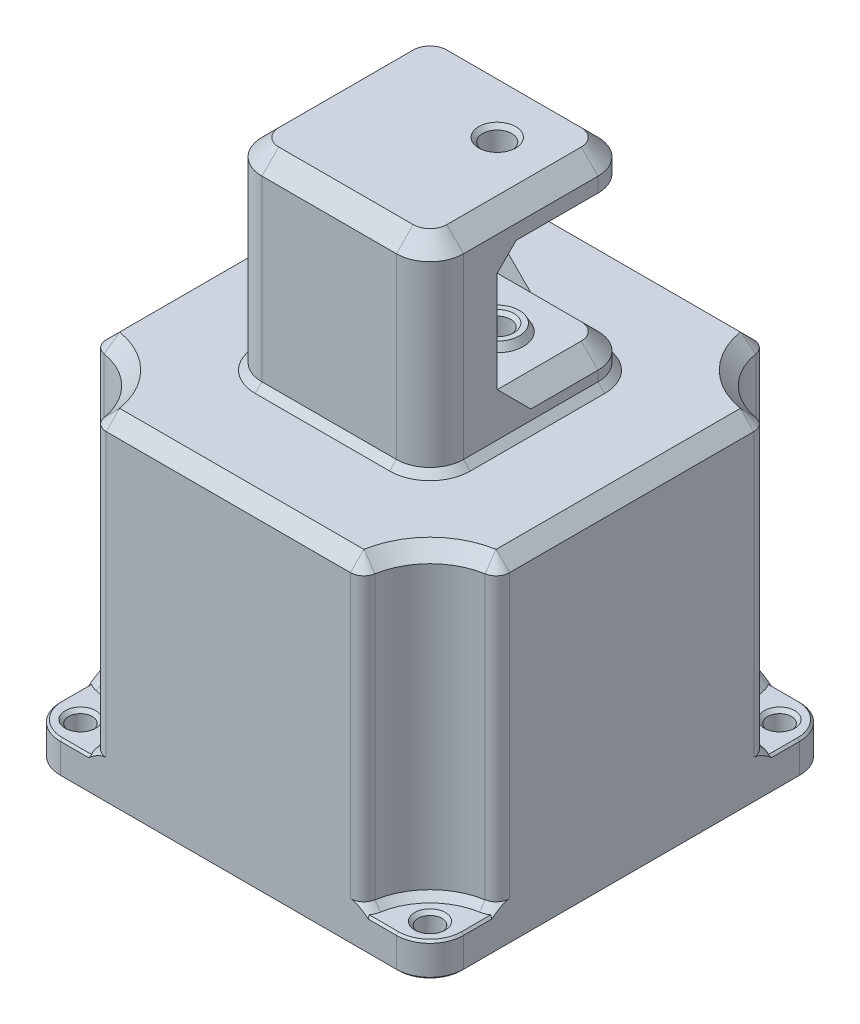
from build123d import *

# Parameters (mm, degrees)
BOSS_EXTRUDE1_DEPTH                  = 6.35
BOSS_EXTRUDE7_DEPTH                  = 63.5
SKETCH2_W                            = 38.1
SKETCH2_H                            = 38.1
BOSS_EXTRUDE2_DEPTH                  = 69.85
BOSS_EXTRUDE3_DEPTH                  = 95.25
BOSS_EXTRUDE4_START                  = 95.25
SKETCH2_5_W                          = 25.4
SKETCH2_5_H                          = 25.4
SKETCH2_5_R                          = 4.175
BOSS_EXTRUDE4_DEPTH                  = 6.35
F_8_0_199_DIAMETER_HOLE1_D           = 5.0546
F_8_0_199_DIAMETER_HOLE1_DEPTH       = 8.89
F_8_0_199_DIAMETER_HOLE1_CSINK_D     = 6.3246
F_8_0_199_DIAMETER_HOLE1_CSINK_ANGLE = 90
F_8_0_199_DIAMETER_HOLE1_TIP         = 1.518555042
F_8_CLEARANCE_HOLE1_AT_2_COUNT       = 2
F_8_CLEARANCE_HOLE1_AT_2_PITCH       = 66.04
F_8_CLEARANCE_HOLE1_AT_3_COUNT       = 2
F_8_CLEARANCE_HOLE1_AT_3_PITCH       = 93.394663659
F_8_CLEARANCE_HOLE1_AT_4_COUNT       = 2
F_8_CLEARANCE_HOLE1_AT_4_PITCH       = 66.04
FILLET2_R                            = 6.35
FILLET4_R                            = 2.54
CHAMFER2_SIZE                        = 3.175
CHAMFER3_SIZE                        = 3.175
CHAMFER5_SIZE                        = 1.27
CHAMFER6_SIZE                        = 2.54
CHAMFER7_SIZE                        = 1.27
CHAMFER4_SIZE                        = 0.396875


# Read off the part's stored shape, not the designer's step: Boss-Extrude5, Boss-Extrude6
# Some blends are built 0.0001 mm under size
with BuildPart() as part:
    # Sketch1 → Boss-Extrude1 (new body)
    with BuildSketch(Plane(origin=(0, 0, 0), x_dir=(1, 0, 0), z_dir=(0, 1, 0))):
        with BuildLine():
            Line((-38.1, -25.4), (-38.1, -38.1))
            Line((-38.1, -38.1), (-25.4, -38.1))
            ThreePointArc((-25.4, -38.1), (-29.119743879, -29.119743879), (-38.1, -25.4))
        make_face()
        with BuildLine():
            ThreePointArc((-38.1, -25.4), (-29.119743879, -29.119743879), (-25.4, -38.1))
            Line((-25.4, -38.1), (25.4, -38.1))
            ThreePointArc((25.4, -38.1), (29.119743879, -29.119743879), (38.1, -25.4))
            Line((38.1, -25.4), (38.1, 25.4))
            ThreePointArc((38.1, 25.4), (29.119743879, 29.119743879), (25.4, 38.1))
            Line((25.4, 38.1), (-25.4, 38.1))
            ThreePointArc((-25.4, 38.1), (-29.119743879, 29.119743879), (-38.1, 25.4))
            Line((-38.1, 25.4), (-38.1, -25.4))
        make_face()
        with BuildLine():
            Line((-38.1, 38.1), (-38.1, 25.4))
            ThreePointArc((-38.1, 25.4), (-29.119743879, 29.119743879), (-25.4, 38.1))
            Line((-25.4, 38.1), (-38.1, 38.1))
        make_face()
        with BuildLine():
            ThreePointArc((25.4, 38.1), (29.119743879, 29.119743879), (38.1, 25.4))
            Line((38.1, 25.4), (38.1, 38.1))
            Line((38.1, 38.1), (25.4, 38.1))
        make_face()
        with BuildLine():
            ThreePointArc((38.1, -25.4), (29.119743879, -29.119743879), (25.4, -38.1))
            Line((25.4, -38.1), (38.1, -38.1))
            Line((38.1, -38.1), (38.1, -25.4))
        make_face()
    extrude(amount=BOSS_EXTRUDE1_DEPTH)

    # Sketch1<3> → Boss-Extrude7 (add)
    with BuildSketch(Plane(origin=(0, 0, 0), x_dir=(1, 0, 0), z_dir=(0, 1, 0))):
        with BuildLine():
            ThreePointArc((-38.1, -25.4), (-29.119743879, -29.119743879), (-25.4, -38.1))
            Line((-25.4, -38.1), (25.4, -38.1))
            ThreePointArc((25.4, -38.1), (29.119743879, -29.119743879), (38.1, -25.4))
            Line((38.1, -25.4), (38.1, 25.4))
            ThreePointArc((38.1, 25.4), (29.119743879, 29.119743879), (25.4, 38.1))
            Line((25.4, 38.1), (-25.4, 38.1))
            ThreePointArc((-25.4, 38.1), (-29.119743879, 29.119743879), (-38.1, 25.4))
            Line((-38.1, 25.4), (-38.1, -25.4))
        make_face()
    extrude(amount=BOSS_EXTRUDE7_DEPTH)

    # Sketch2 → Boss-Extrude2 (add)
    with BuildSketch(Plane(origin=(0, 0, 0), x_dir=(1, 0, 0), z_dir=(0, 1, 0))):
        Rectangle(SKETCH2_W, SKETCH2_H)
    extrude(amount=BOSS_EXTRUDE2_DEPTH)

    # Sketch2<3> → Boss-Extrude3 (add)
    with BuildSketch(Plane(origin=(0, 0, 0), x_dir=(1, 0, 0), z_dir=(0, 1, 0))):
        Polygon((-19.05, 19.05), (-19.05, -19.05), (19.05, -19.05), (19.05, -6.35), (-6.35, -6.35), (-6.35, 19.05), align=None)
    extrude(amount=BOSS_EXTRUDE3_DEPTH)

    # Sketch2<5> → Boss-Extrude4 (add)
    # profile 1 of 3: a face of its own
    with BuildSketch(Plane(origin=(0, 0, 0), x_dir=(1, 0, 0), z_dir=(0, 1, 0)).offset(BOSS_EXTRUDE4_START)):
        Polygon((-19.05, 19.05), (-19.05, -19.05), (19.05, -19.05), (19.05, -6.35), (-6.35, -6.35), (-6.35, 19.05), align=None)
    # profile 2 of 3: a face of its own
    with BuildSketch(Plane(origin=(0, 0, 0), x_dir=(1, 0, 0), z_dir=(0, 1, 0)).offset(BOSS_EXTRUDE4_START)):
        with Locations((6.35, 6.35)):
            Rectangle(SKETCH2_5_W, SKETCH2_5_H)
        with Locations((6.35, 6.35)):
            Circle(SKETCH2_5_R, mode=Mode.SUBTRACT)
    # profile 3 of 3: a face of its own
    with BuildSketch(Plane(origin=(0, 0, 0), x_dir=(1, 0, 0), z_dir=(0, 1, 0)).offset(BOSS_EXTRUDE4_START)):
        with Locations((6.35, 6.35)):
            Circle(SKETCH2_5_R)
    extrude(amount=BOSS_EXTRUDE4_DEPTH)

    # Boss-Extrude5 outline → Boss-Extrude5 (revolve)
    with BuildSketch(Plane(origin=(6.35, 0, -6.35), x_dir=(1, 0, 0), z_dir=(0, 0, 1))):
        Polygon((4.175, 71.2), (0, 71.2), (0, 69.85), (4.954422863, 69.85), align=None)
    revolve(axis=Axis((6.35, 0, -6.35), (0, 1, 0)))

    # Boss-Extrude6 outline → Boss-Extrude6 (revolve)
    with BuildSketch(Plane(origin=(6.35, 0, -6.35), x_dir=(1, 0, 0), z_dir=(0, 0, 1))):
        Polygon((0, 95.25), (0, 93.9), (4.175, 93.9), (4.954422863, 95.25), align=None)
    revolve(axis=Axis((6.35, 0, -6.35), (0, 1, 0)))

    # #8 (0.199) Diameter Hole1
    with Locations(Plane(origin=(0, 71.2, 0), x_dir=(1, 0, 0), z_dir=(0, 1, 0))):
        with Locations((6.35, 6.35)):
            CounterSinkHole(F_8_0_199_DIAMETER_HOLE1_D / 2, F_8_0_199_DIAMETER_HOLE1_CSINK_D / 2, depth=F_8_0_199_DIAMETER_HOLE1_DEPTH, counter_sink_angle=F_8_0_199_DIAMETER_HOLE1_CSINK_ANGLE)
            with Locations((0, 0, -(F_8_0_199_DIAMETER_HOLE1_DEPTH + F_8_0_199_DIAMETER_HOLE1_TIP / 2))):  # 118° drill point
                Cone(0, F_8_0_199_DIAMETER_HOLE1_D / 2, F_8_0_199_DIAMETER_HOLE1_TIP, mode=Mode.SUBTRACT)

    # Sketch8 → M5 Clearance Hole1 (revolve, cut)
    with BuildSketch(Plane(origin=(6.35, 93.9, -6.35), x_dir=(0, 0, -1), z_dir=(1, 0, 0))):
        Polygon((0, 0), (0, 7.7), (3.5, 7.7), (2.75, 6.95), (2.75, 0.75), (3.5, 0), align=None)
    revolve(axis=Axis((6.35, 87.55, -6.35), (0, 1, 0)), mode=Mode.SUBTRACT)

    # Sketch17 → #8 Clearance Hole1 (revolve, cut)
    with BuildSketch(Plane(origin=(-33.02, 6.35, -33.02), x_dir=(0, 0, 1), z_dir=(1, 0, 0))):
        Polygon((0, 0), (0, 6.35), (2.8829, 6.35), (2.2479, 5.715), (2.2479, 0.635), (2.8829, 0), align=None)
    f_8_clearance_hole1 = revolve(axis=Axis((-33.02, 12.7, -33.02), (0, -1, 0)), mode=Mode.SUBTRACT)

    # #8 Clearance Hole1 at 2: #8 Clearance Hole1 ×2
    with Locations(*[(i * F_8_CLEARANCE_HOLE1_AT_2_PITCH, 0, 0) for i in range(1, F_8_CLEARANCE_HOLE1_AT_2_COUNT)]):
        add(f_8_clearance_hole1, mode=Mode.SUBTRACT)

    # #8 Clearance Hole1 at 3: #8 Clearance Hole1 ×2
    with Locations(*[Vector(0.7071067811865476, 0, 0.7071067811865476) * (i * F_8_CLEARANCE_HOLE1_AT_3_PITCH) for i in range(1, F_8_CLEARANCE_HOLE1_AT_3_COUNT)]):
        add(f_8_clearance_hole1, mode=Mode.SUBTRACT)

    # #8 Clearance Hole1 at 4: #8 Clearance Hole1 ×2
    with Locations(*[(0, 0, i * F_8_CLEARANCE_HOLE1_AT_4_PITCH) for i in range(1, F_8_CLEARANCE_HOLE1_AT_4_COUNT)]):
        add(f_8_clearance_hole1, mode=Mode.SUBTRACT)

    # Fillet2
    fillet2_edges = [part.edges().sort_by_distance(p)[0] for p in [
        (-6.35, 82.55, 6.35),
        (-38.1, 3.175, 38.1),
        (-38.1, 3.175, -38.1),
        (38.1, 3.175, -38.1),
        (38.1, 3.175, 38.1),
        (19.05, 98.425, -19.05),
        (19.05, 66.675, -19.05),
        (-19.05, 82.55, -19.05),
        (-19.05, 82.55, 19.05),
        (19.05, 82.55, 19.05),
    ]]
    fillet(fillet2_edges, radius=FILLET2_R)

    # Fillet4
    fillet4_edges = [part.edges().sort_by_distance(p)[0] for p in [
        (-25.4, 34.925, 38.1),
        (25.4, 34.925, 38.1),
        (38.1, 34.925, 25.4),
        (38.1, 34.925, -25.4),
        (25.4, 34.925, -38.1),
        (-25.4, 34.925, -38.1),
        (-38.1, 34.925, -25.4),
        (-38.1, 34.925, 25.4),
    ]]
    fillet(fillet4_edges, radius=FILLET4_R)

    # Chamfer2
    chamfer2_edges = [part.edges().sort_by_distance(p)[0] for p in [
        (-6.35, 95.25, -9.525),
        (9.525, 95.25, 6.35),
        (-6.35, 69.85, -9.525),
        (9.525, 69.85, 6.35),
        (-4.490128061, 69.85, 4.490128061),
        (-4.490128061, 95.25, 4.490128061),
    ]]
    chamfer(chamfer2_edges, length=CHAMFER2_SIZE)

    # Chamfer3
    chamfer3_edges = [part.edges().sort_by_distance(p)[0] for p in [
        (17.190128061, 69.85, -17.190128061),
        (0, 101.6, -19.05),
        (19.05, 101.6, 0),
        (-19.05, 101.6, 0),
        (0, 101.6, 19.05),
        (17.190128061, 101.6, 17.190128061),
        (-17.190128061, 101.6, 17.190128061),
        (-17.190128061, 101.6, -17.190128061),
        (17.190128061, 101.6, -17.190128061),
        (19.05, 69.85, -4.7625),
        (4.7625, 69.85, -19.05),
    ]]
    chamfer(chamfer3_edges, length=CHAMFER3_SIZE)

    # Chamfer5
    chamfer5_edges = [part.edges().sort_by_distance(p)[0] for p in [
        (0, 63.5, -19.05),
        (19.05, 63.5, 0),
        (-19.05, 63.5, 0),
        (0, 63.5, 19.05),
        (-17.190128061, 63.5, -17.190128061),
        (17.190128061, 63.5, -17.190128061),
        (-17.190128061, 63.5, 17.190128061),
        (17.190128061, 63.5, 17.190128061),
    ]]
    chamfer(chamfer5_edges, length=CHAMFER5_SIZE)

    # Chamfer6
    chamfer6_edges = [part.edges().sort_by_distance(p)[0] for p in [
        (-38.1, 63.5, 0),
        (-29.119743879, 63.5, -29.119743879),
        (0, 63.5, 38.1),
        (29.119743879, 63.5, 29.119743879),
        (38.1, 63.5, 0),
        (29.119743879, 63.5, -29.119743879),
        (0, 63.5, -38.1),
        (-29.119743879, 63.5, 29.119743879),
        (24.712720301, 63.5, 37.499957044),
        (37.499957044, 63.5, 24.712720301),
        (37.499957044, 63.5, -24.712720301),
        (24.712720301, 63.5, -37.499957044),
        (-24.712720301, 63.5, 37.499957044),
        (-37.499957044, 63.5, 24.712720301),
        (-24.712720301, 63.5, -37.499957044),
        (-37.499957044, 63.5, -24.712720301),
    ]]
    chamfer(chamfer6_edges, length=CHAMFER6_SIZE - 0.0001)  # a hair under: the kernel refuses the full size

    # Chamfer7
    # the kernel refuses this chamfer: 1.27 mm, written as the material it adds along each edge
    with BuildSketch(Plane(origin=(-38.1, 6.35, -38.1), x_dir=(0.9860132971832694, 0, 0.1666666666666668), z_dir=(0.1666666666666668, 0, -0.9860132971832694))) as chamfer7_piece_1:
        Polygon((12.7, -CHAMFER7_SIZE), (12.7 - CHAMFER7_SIZE, 0), (12.7, 0), align=None)
    revolve(axis=Axis((-38.1, 6.35, -38.1), (0, -1, 0)), revolution_arc=70.811863546)
    with BuildSketch(Plane(origin=(-38.1, 6.35, 38.1), x_dir=(0.16666666666666616, 0, -0.9860132971832694), z_dir=(-0.9860132971832694, 0, -0.16666666666666616))) as chamfer7_piece_2:
        Polygon((12.7, -CHAMFER7_SIZE), (12.7 - CHAMFER7_SIZE, 0), (12.7, 0), align=None)
    revolve(axis=Axis((-38.1, 6.35, 38.1), (0, -1, 0)), revolution_arc=70.811863546)
    with BuildSketch(Plane(origin=(38.1, 6.35, -38.1), x_dir=(-0.1666666666666665, 0, 0.9860132971832694), z_dir=(0.9860132971832694, 0, 0.1666666666666665))) as chamfer7_piece_3:
        Polygon((12.7, -CHAMFER7_SIZE), (12.7 - CHAMFER7_SIZE, 0), (12.7, 0), align=None)
    revolve(axis=Axis((38.1, 6.35, -38.1), (0, -1, 0)), revolution_arc=70.811863546)
    with BuildSketch(Plane(origin=(38.1, 6.35, 38.1), x_dir=(-0.986013297183269, 0, -0.16666666666666893), z_dir=(-0.16666666666666893, 0, 0.986013297183269))) as chamfer7_piece_4:
        Polygon((12.7, -CHAMFER7_SIZE), (12.7 - CHAMFER7_SIZE, 0), (12.7, 0), align=None)
    revolve(axis=Axis((38.1, 6.35, 38.1), (0, -1, 0)), revolution_arc=70.811863546)
    with BuildSketch(Plane(origin=(-35.56, 6.35, -23.073157351), x_dir=(-0.2807184525796538, 0, 0.9597901595563922), z_dir=(0.9597901595563922, 0, 0.2807184525796538))) as chamfer7_piece_5_section:
        Polygon((2.54, -CHAMFER7_SIZE), (2.54 + CHAMFER7_SIZE, 0), (2.54, 0), align=None)
    chamfer7_piece_5 = revolve(axis=Axis((-35.56, 6.35, -23.073157351), (0, -1, 0)), revolution_arc=154.1028429, mode=Mode.PRIVATE)
    chamfer7_piece_5 = split(chamfer7_piece_5, bisect_by=Plane(origin=(-38.1, 6.870447209, -24.8557184), z_dir=(1, 0, 0)), keep=Keep.TOP, mode=Mode.PRIVATE)
    add(chamfer7_piece_5)
    with BuildSketch(Plane(origin=(-23.073157351, 6.35, -35.56), x_dir=(-0.986013297183269, 0, -0.16666666666666888), z_dir=(-0.16666666666666888, 0, 0.986013297183269))) as chamfer7_piece_6_section:
        Polygon((2.54, -CHAMFER7_SIZE), (2.54 + CHAMFER7_SIZE, 0), (2.54, 0), align=None)
    chamfer7_piece_6 = revolve(axis=Axis((-23.073157351, 6.35, -35.56), (0, -1, 0)), revolution_arc=154.1028429, mode=Mode.PRIVATE)
    chamfer7_piece_6 = split(chamfer7_piece_6, bisect_by=Plane(origin=(-24.855718177, 6.870446862, -38.1), z_dir=(0, 0, 1)), keep=Keep.TOP, mode=Mode.PRIVATE)
    add(chamfer7_piece_6)
    with BuildSketch(Plane(origin=(-35.56, 6.35, 23.073157351), x_dir=(-0.2807184525796567, 0, -0.9597901595563914), z_dir=(0.9597901595563914, 0, -0.2807184525796567))) as chamfer7_piece_7_section:
        Polygon((2.54, CHAMFER7_SIZE), (2.54 + CHAMFER7_SIZE, 0), (2.54, 0), align=None)
    chamfer7_piece_7 = revolve(axis=Axis((-35.56, 6.35, 23.073157351), (0, 1, 0)), revolution_arc=154.1028429, mode=Mode.PRIVATE)
    chamfer7_piece_7 = split(chamfer7_piece_7, bisect_by=Plane(origin=(-38.1, 6.870447528, 24.855717867), z_dir=(1, 0, 0)), keep=Keep.TOP, mode=Mode.PRIVATE)
    add(chamfer7_piece_7)
    with BuildSketch(Plane(origin=(-23.073157351, 6.35, 35.56), x_dir=(-0.9860132971832694, 0, 0.16666666666666613), z_dir=(-0.16666666666666613, 0, -0.9860132971832694))) as chamfer7_piece_8_section:
        Polygon((2.54, CHAMFER7_SIZE), (2.54 + CHAMFER7_SIZE, 0), (2.54, 0), align=None)
    chamfer7_piece_8 = revolve(axis=Axis((-23.073157351, 6.35, 35.56), (0, 1, 0)), revolution_arc=154.1028429, mode=Mode.PRIVATE)
    chamfer7_piece_8 = split(chamfer7_piece_8, bisect_by=Plane(origin=(-24.855718507, 6.870447099, 38.1), z_dir=(0, 0, -1)), keep=Keep.TOP, mode=Mode.PRIVATE)
    add(chamfer7_piece_8)
    with BuildSketch(Plane(origin=(23.073157351, 6.35, -35.56), x_dir=(-0.9597901595563914, 0, -0.2807184525796567), z_dir=(-0.2807184525796567, 0, 0.9597901595563914))) as chamfer7_piece_9_section:
        Polygon((2.54, -CHAMFER7_SIZE), (2.54 + CHAMFER7_SIZE, 0), (2.54, 0), align=None)
    chamfer7_piece_9 = revolve(axis=Axis((23.073157351, 6.35, -35.56), (0, -1, 0)), revolution_arc=154.1028429, mode=Mode.PRIVATE)
    chamfer7_piece_9 = split(chamfer7_piece_9, bisect_by=Plane(origin=(24.8557184, 6.870447209, -38.1), z_dir=(0, 0, 1)), keep=Keep.TOP, mode=Mode.PRIVATE)
    add(chamfer7_piece_9)
    with BuildSketch(Plane(origin=(35.56, 6.35, -23.073157351), x_dir=(0.2807184525796567, 0, 0.9597901595563914), z_dir=(-0.9597901595563914, 0, 0.2807184525796567))) as chamfer7_piece_10_section:
        Polygon((2.54, CHAMFER7_SIZE), (2.54 + CHAMFER7_SIZE, 0), (2.54, 0), align=None)
    chamfer7_piece_10 = revolve(axis=Axis((35.56, 6.35, -23.073157351), (0, 1, 0)), revolution_arc=154.1028429, mode=Mode.PRIVATE)
    chamfer7_piece_10 = split(chamfer7_piece_10, bisect_by=Plane(origin=(38.1, 6.870447528, -24.855717867), z_dir=(-1, 0, 0)), keep=Keep.TOP, mode=Mode.PRIVATE)
    add(chamfer7_piece_10)
    with BuildSketch(Plane(origin=(35.56, 6.35, 23.073157351), x_dir=(0.2807184525796508, 0, -0.959790159556393), z_dir=(-0.959790159556393, 0, -0.2807184525796508))) as chamfer7_piece_11_section:
        Polygon((2.54, -CHAMFER7_SIZE), (2.54 + CHAMFER7_SIZE, 0), (2.54, 0), align=None)
    chamfer7_piece_11 = revolve(axis=Axis((35.56, 6.35, 23.073157351), (0, -1, 0)), revolution_arc=154.1028429, mode=Mode.PRIVATE)
    chamfer7_piece_11 = split(chamfer7_piece_11, bisect_by=Plane(origin=(38.1, 6.870447209, 24.8557184), z_dir=(-1, 0, 0)), keep=Keep.TOP, mode=Mode.PRIVATE)
    add(chamfer7_piece_11)
    with BuildSketch(Plane(origin=(23.073157351, 6.35, 35.56), x_dir=(-0.9597901595563914, 0, 0.2807184525796567), z_dir=(-0.2807184525796567, 0, -0.9597901595563914))) as chamfer7_piece_12_section:
        Polygon((2.54, CHAMFER7_SIZE), (2.54 + CHAMFER7_SIZE, 0), (2.54, 0), align=None)
    chamfer7_piece_12 = revolve(axis=Axis((23.073157351, 6.35, 35.56), (0, 1, 0)), revolution_arc=154.1028429, mode=Mode.PRIVATE)
    chamfer7_piece_12 = split(chamfer7_piece_12, bisect_by=Plane(origin=(24.855717867, 6.870447528, 38.1), z_dir=(0, 0, -1)), keep=Keep.TOP, mode=Mode.PRIVATE)
    add(chamfer7_piece_12)

    # Chamfer4
    chamfer4_edges = [part.edges().sort_by_distance(p)[0] for p in [
        (4.7625, 95.25, -19.05),
        (19.05, 95.25, -4.7625),
        (17.190128061, 95.25, -17.190128061),
        (-38.1, 0, 0),
        (-38.1, 6.35, 28.831481841),
        (0, 0, -38.1),
        (38.1, 0, 0),
        (0, 0, 38.1),
        (36.240128061, 0, -36.240128061),
        (36.240128061, 0, 36.240128061),
        (-36.240128061, 0, 36.240128061),
        (-36.240128061, 0, -36.240128061),
        (-28.831481841, 6.35, -38.1),
        (-36.240128061, 6.35, -36.240128061),
        (-28.831481841, 6.35, 38.1),
        (-36.240128061, 6.35, 36.240128061),
        (38.1, 6.35, 28.831481841),
        (36.240128061, 6.35, 36.240128061),
        (36.240128061, 6.35, -36.240128061),
        (28.831481841, 6.35, 38.1),
        (38.1, 6.35, -28.831481841),
        (28.831481841, 6.35, -38.1),
        (-38.1, 6.35, -28.831481841),
    ]]
    chamfer(chamfer4_edges, length=CHAMFER4_SIZE)


solid = part.part
